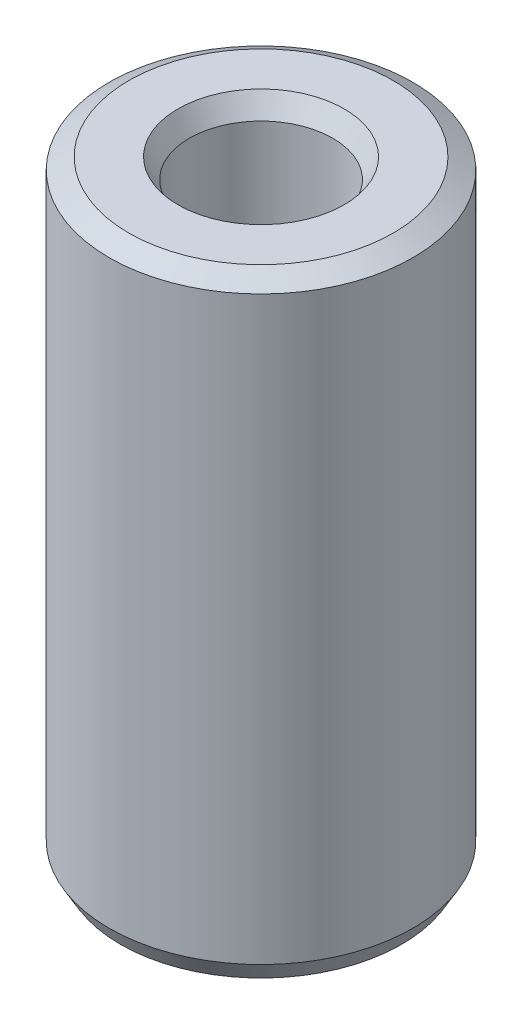
from build123d import *
from OCP.BRepFilletAPI import BRepFilletAPI_MakeChamfer

# Parameters (mm, degrees)
SKETCH1_R           = 50
BOSS_EXTRUDE1_DEPTH = 201.397096684
SKETCH2_R           = 23.61007113
CUT_EXTRUDE1_DEPTH  = 214.449737767
CHAMFER1_SIZE       = 3.750463024
CHAMFER1_SIZE2      = 6.49599251


with BuildPart() as part:
    # Sketch1 → Boss-Extrude1 (new body)
    with BuildSketch(Plane(origin=(0, 0, 0), x_dir=(1, 0, 0), z_dir=(0, 1, 0))):
        Circle(SKETCH1_R)
    extrude(amount=BOSS_EXTRUDE1_DEPTH)

    # Sketch2 → Cut-Extrude1 (cut, through all)
    with BuildSketch(Plane(origin=(0, 0, 0), x_dir=(1, 0, 0), z_dir=(0, 1, 0))):
        Circle(SKETCH2_R)
    extrude(amount=CUT_EXTRUDE1_DEPTH, mode=Mode.SUBTRACT)

    # Chamfer1: one chamfer whose edges measure the first distance from different faces: ONE call of the kernel's chamfer builder (chamfer() names one face for all edges)
    chamfer1_edges_1 = [part.edges().sort_by_distance(p)[0] for p in [
        (-23.61007113, 201.397096684, 0),
    ]]
    chamfer1_side_1 = [part.faces().sort_by_distance(p)[0] for p in [
        (-48.585786438, 201.397096684, 0),
    ]]
    chamfer1_edges_2 = [part.edges().sort_by_distance(p)[0] for p in [
        (-23.61007113, 0, 0),
    ]]
    chamfer1_side_2 = [part.faces().sort_by_distance(p)[0] for p in [
        (-23.61007113, 100.698548342, 0),
    ]]
    chamfer1_edges_3 = [part.edges().sort_by_distance(p)[0] for p in [
        (-50, 0, 0),
    ]]
    chamfer1_side_3 = [part.faces().sort_by_distance(p)[0] for p in [
        (-48.585786438, 0, 0),
    ]]
    chamfer1_edges_4 = [part.edges().sort_by_distance(p)[0] for p in [
        (-50, 201.397096684, 0),
    ]]
    chamfer1_side_4 = [part.faces().sort_by_distance(p)[0] for p in [
        (-50, 100.698548342, 0),
    ]]
    chamfer1 = BRepFilletAPI_MakeChamfer(part.part.solid().wrapped)
    for e in chamfer1_edges_1:
        chamfer1.Add(CHAMFER1_SIZE, CHAMFER1_SIZE2, e.wrapped, chamfer1_side_1[0].wrapped)  # the first distance lies on this face
    for e in chamfer1_edges_2:
        chamfer1.Add(CHAMFER1_SIZE, CHAMFER1_SIZE2, e.wrapped, chamfer1_side_2[0].wrapped)  # the first distance lies on this face
    for e in chamfer1_edges_3:
        chamfer1.Add(CHAMFER1_SIZE, CHAMFER1_SIZE2, e.wrapped, chamfer1_side_3[0].wrapped)  # the first distance lies on this face
    for e in chamfer1_edges_4:
        chamfer1.Add(CHAMFER1_SIZE, CHAMFER1_SIZE2, e.wrapped, chamfer1_side_4[0].wrapped)  # the first distance lies on this face
    add(Compound.cast(chamfer1.Shape()), mode=Mode.REPLACE)


solid = part.part
